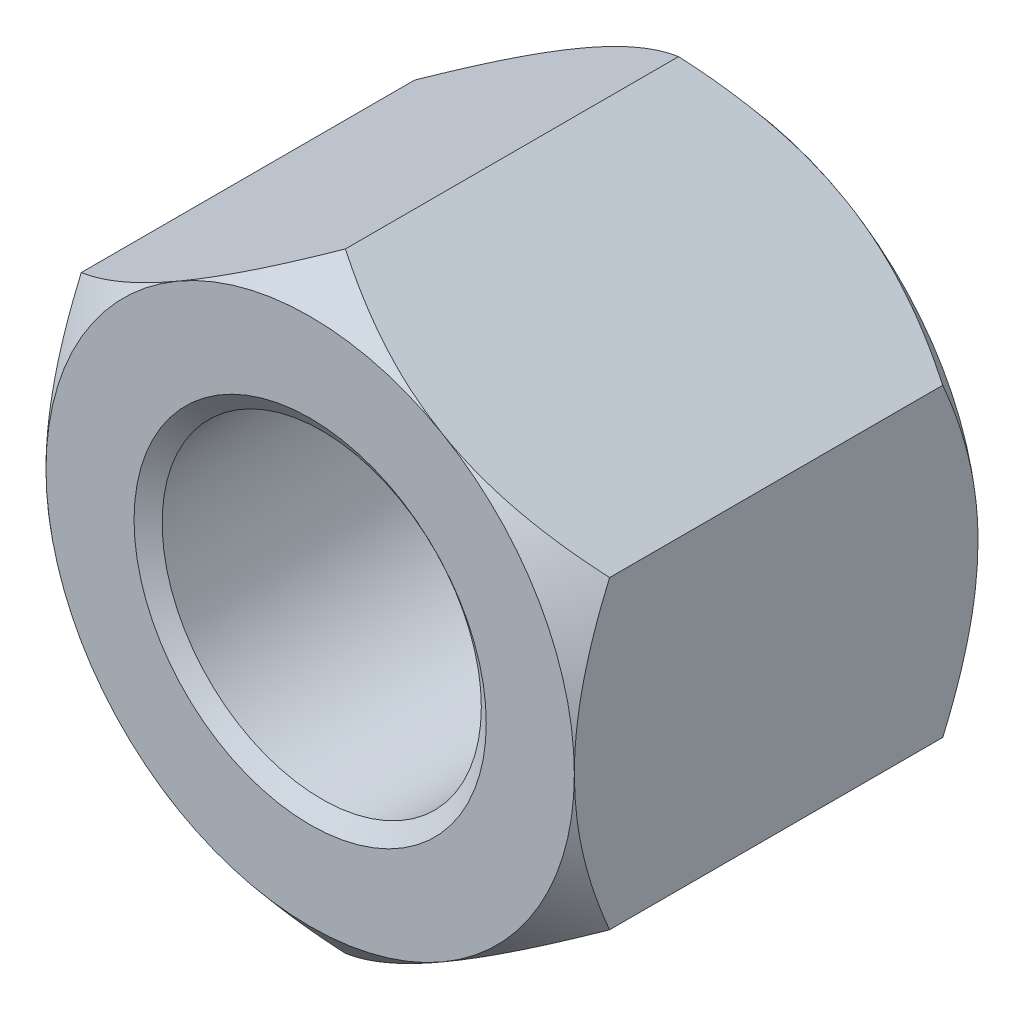
from build123d import *

# Parameters (mm, degrees)
THREADSCHEMATIC_START     = -14.5542
THREADSCHEMATIC_OUTLINE_R = 5.75437
THREADSCHEMATIC_DEPTH     = 14.5542


# Read off the part's stored shape, not the designer's step: ThreadSchematic
with BuildPart() as part:
    # ThreadSchematic outline → ThreadSchematic (new body)
    with BuildSketch(Plane.XY.offset(THREADSCHEMATIC_START)):
        Polygon((9.525, 5.499261314), (0, 10.998522628), (-9.525, 5.499261314), (-9.525, -5.499261314), (0, -10.998522628), (9.525, -5.499261314), align=None)
        Circle(THREADSCHEMATIC_OUTLINE_R, mode=Mode.SUBTRACT)
    extrude(amount=THREADSCHEMATIC_DEPTH)

    # Sketch3 → Double-Chamfer (revolve, cut)
    with BuildSketch(Plane(origin=(0, 0, 0), x_dir=(0, 0, -1), z_dir=(1, 0, 0))):
        Polygon((14.5542, 9.525), (13.2842, 10.998522628), (13.2842, 23.698522628), (27.2542, 23.698522628), (27.2542, 9.525), align=None)
        Polygon((1.27, 23.698522628), (-12.7, 23.698522628), (-12.7, 9.525), (0, 9.525), (1.27, 10.998522628), align=None)
    revolve(axis=Axis((0, 0, 0), (0, 0, -1)), mode=Mode.SUBTRACT)

    # EndChamferSke → EndChamfer (revolve, cut)
    with BuildSketch(Plane(origin=(0, 0, 0), x_dir=(0, 0, -1), z_dir=(1, 0, 0)), mode=Mode.PRIVATE) as endchamfer_sk:
        Polygon((14.5288, 6.35), (14.070028922, 5.694807), (14.5796, 5.694807), (14.5796, 6.35), align=None)
        Polygon((-0.0508, 6.35), (0, 6.35), (0.458771078, 5.694807), (-0.0508, 5.694807), align=None)
    revolve(endchamfer_sk.sketch.rotate(Axis((0, 0, -25.037505729), (0, 0, -1)), 90), axis=Axis((0, 0, -25.037505729), (0, 0, -1)), mode=Mode.SUBTRACT)


solid = part.part
